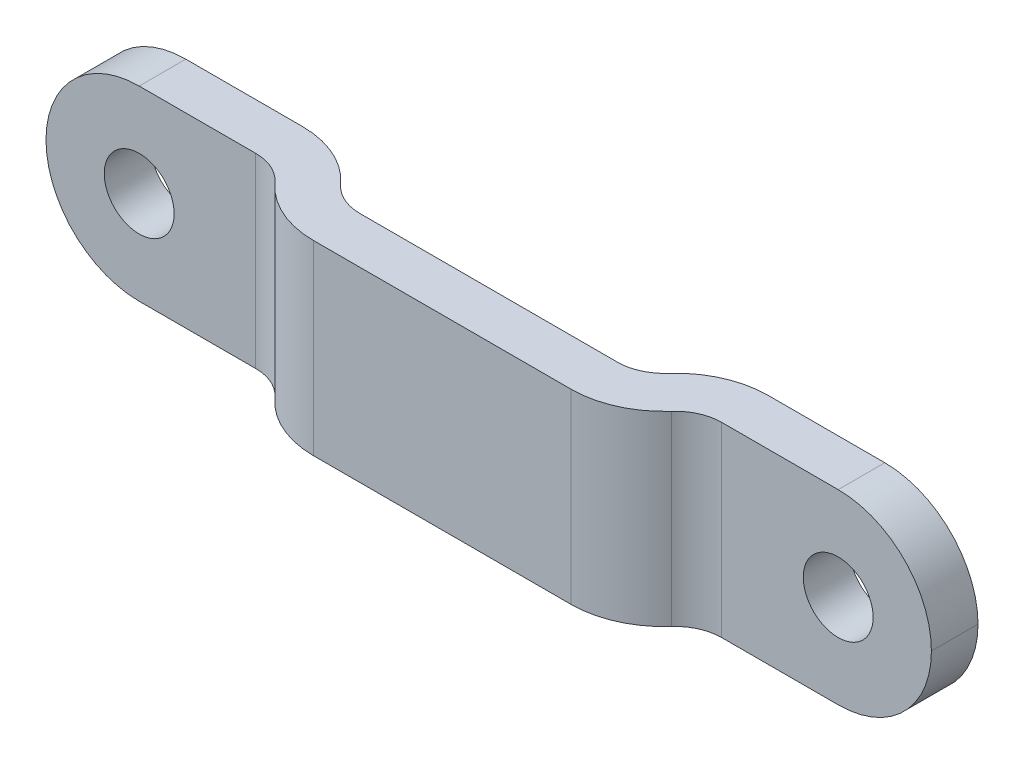
from build123d import *

# Parameters (mm, degrees)
BASE_EXTRUDE_DEPTH = 6.35
FILLET1_R          = 6.35
SKETCH2_R          = 2.38125
CUT_EXTRUDE1_DEPTH = 31.986763807


with BuildPart() as part:
    # Sketch1 → Base-Extrude (new, symmetric)
    with BuildSketch(Plane(origin=(0, 0, 0), x_dir=(1, 0, 0), z_dir=(0, 1, 0))):
        with BuildLine():
            Line((-30.1625, 0), (-15.875, 0))
            ThreePointArc((-15.875, 0), (-13.282623356, -0.5532696), (-11.141989448, -2.116666667))
            ThreePointArc((-11.141989448, -2.116666667), (-10.071672494, -2.8983652), (-8.775484171, -3.175))
            Line((-8.775484171, -3.175), (8.775484171, -3.175))
            ThreePointArc((8.775484171, -3.175), (10.071672494, -2.8983652), (11.141989448, -2.116666667))
            ThreePointArc((11.141989448, -2.116666667), (13.282623356, -0.5532696), (15.875, 0))
            Line((15.875, 0), (30.1625, 0))
            Line((30.1625, 0), (30.1625, -3.175))
            Line((30.1625, -3.175), (15.875, -3.175))
            ThreePointArc((15.875, -3.175), (14.578811678, -3.4516348), (13.508494724, -4.233333333))
            ThreePointArc((13.508494724, -4.233333333), (11.367860816, -5.7967304), (8.775484171, -6.35))
            Line((8.775484171, -6.35), (-8.775484171, -6.35))
            ThreePointArc((-8.775484171, -6.35), (-11.367860816, -5.7967304), (-13.508494724, -4.233333333))
            ThreePointArc((-13.508494724, -4.233333333), (-14.578811678, -3.4516348), (-15.875, -3.175))
            Line((-15.875, -3.175), (-30.1625, -3.175))
            Line((-30.1625, -3.175), (-30.1625, 0))
        make_face()
    extrude(amount=BASE_EXTRUDE_DEPTH, both=True)

    # Fillet1
    fillet1_edges = [part.edges().sort_by_distance(p)[0] for p in [
        (30.1625, -6.35, 1.5875),
        (-30.1625, -6.35, 1.5875),
        (30.1625, 6.35, 1.5875),
        (-30.1625, 6.35, 1.5875),
    ]]
    fillet(fillet1_edges, radius=FILLET1_R - 0.0001)  # a hair under: the kernel refuses the full size

    # Sketch2 → Cut-Extrude1 (cut, through all)
    with BuildSketch(Plane.XY.offset(3.175)):
        with Locations((23.8125, 0)):
            Circle(SKETCH2_R)
        with Locations((-23.8125, 0)):
            Circle(SKETCH2_R)
    extrude(amount=-CUT_EXTRUDE1_DEPTH, mode=Mode.SUBTRACT)


solid = part.part
